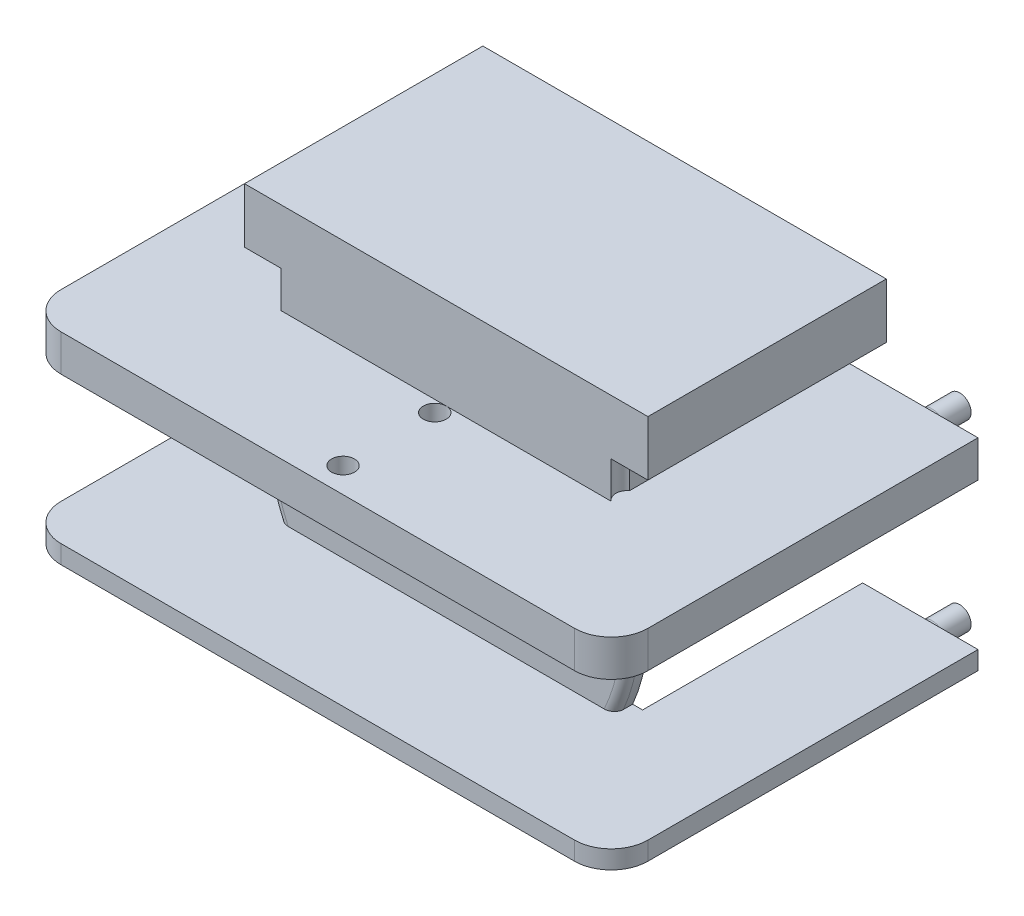
from build123d import *

# Parameters (mm, degrees)
BOSS_EXTRUDE1_DEPTH     = 1
SKETCH2_R               = 1.475
BOSS_EXTRUDE2_DEPTH     = 14
SKETCH3_R               = 3.5
BOSS_EXTRUDE3_DEPTH     = 1
SKETCH4_W               = 2
SKETCH4_H               = 17
BOSS_EXTRUDE4_DEPTH     = 12
SKETCH5_W               = 18
SKETCH5_H               = 2
BOSS_EXTRUDE5_DEPTH     = 12
SKETCH6_W               = 13
SKETCH6_H               = 2
BOSS_EXTRUDE6_DEPTH     = 5
BOSS_EXTRUDE7_DEPTH     = 12
CUT_EXTRUDE1_DEPTH      = 24.366642891
SKETCH9_W               = 2.937742252
SKETCH9_H               = 8
CUT_EXTRUDE2_DEPTH      = 12
CUT_EXTRUDE11_START     = -12
SKETCH21_R              = 10.5
SKETCH21_R_2            = 3.5
CUT_EXTRUDE11_DEPTH     = 12
SKETCH10_W              = 32
SKETCH10_H              = 2
BOSS_EXTRUDE8_DEPTH     = 7
FILLET1_R               = 0.5
SKETCH11_R              = 0.625
BOSS_EXTRUDE9_DEPTH     = 2
SKETCH14_W              = 2
SKETCH14_H              = 2
CUT_EXTRUDE5_DEPTH      = 28.874719859
SKETCH12_R              = 0.675
CUT_EXTRUDE3_DEPTH      = 2.5
CUT_EXTRUDE6_DEPTH      = 2
FILLET2_R               = 0.5
FILLET3_R               = 0.5
FILLET4_R               = 2
CUT_EXTRUDE7_DEPTH      = 28.221315288
CUT_EXTRUDE7_DEPTH_BACK = 1
SKETCH19_R              = 0.625
CUT_EXTRUDE9_DEPTH      = 2


with BuildPart() as part:
    # Sketch1 → Boss-Extrude1 (new body)
    with BuildSketch(Plane.XY):
        Polygon((-11, 6), (-11, 11), (11, 11), (11, 6), (11, -6), (-11, -6), align=None)
    extrude(amount=BOSS_EXTRUDE1_DEPTH)

    # Sketch2 → Boss-Extrude2 (add)
    with BuildSketch(Plane(origin=(0, 0, 0), x_dir=(-1, 0, 0), z_dir=(0, 0, -1))):
        with Locations(Location((0, 0, 0), (0, 0, 180))):
            Circle(SKETCH2_R)
    extrude(amount=BOSS_EXTRUDE2_DEPTH)

    # Sketch3 → Boss-Extrude3 (add)
    with BuildSketch(Plane(origin=(0, 0, 0), x_dir=(-1, 0, 0), z_dir=(0, 0, -1))):
        with Locations(Location((0, 0, 0), (0, 0, 180))):
            Circle(SKETCH3_R)
    extrude(amount=BOSS_EXTRUDE3_DEPTH)

    # Sketch4 → Boss-Extrude4 (add)
    with BuildSketch(Plane(origin=(0, 0, 0), x_dir=(-1, 0, 0), z_dir=(0, 0, -1))):
        with Locations((10, 2.5)):
            Rectangle(SKETCH4_W, SKETCH4_H)
        with Locations((-10, 2.5)):
            Rectangle(SKETCH4_W, SKETCH4_H)
    extrude(amount=BOSS_EXTRUDE4_DEPTH)

    # Sketch5 → Boss-Extrude5 (add)
    with BuildSketch(Plane(origin=(0, 0, 0), x_dir=(-1, 0, 0), z_dir=(0, 0, -1))):
        with Locations((0, 10)):
            Rectangle(SKETCH5_W, SKETCH5_H)
    extrude(amount=BOSS_EXTRUDE5_DEPTH)

    # Sketch6 → Boss-Extrude6 (add)
    with BuildSketch(Plane(origin=(11, 0, 0), x_dir=(0, 0, -1), z_dir=(1, 0, 0))):
        with Locations((5.5, -5)):
            Rectangle(SKETCH6_W, SKETCH6_H)
        with Locations((5.5, 5)):
            Rectangle(SKETCH6_W, SKETCH6_H)
    boss_extrude6 = extrude(amount=BOSS_EXTRUDE6_DEPTH)

    # Mirror1: Boss-Extrude6 across plane
    add(boss_extrude6.mirror(Plane(origin=(0, 0, 0), x_dir=(0, 0, 1), z_dir=(1, 0, 0))))

    # Sketch7 → Boss-Extrude7 (add)
    with BuildSketch(Plane(origin=(0, 0, -12), x_dir=(-1, 0, 0), z_dir=(0, 0, -1))):
        with BuildLine():
            ThreePointArc((-6.708203932, -6), (-8.407551231, -3.211398808), (-9, 0))
            Line((-9, 0), (-9, -6))
            Line((-9, -6), (-6.708203932, -6))
        make_face()
        with BuildLine():
            Line((-9, 9), (-9, 0))
            ThreePointArc((-9, 0), (-6.363961031, 6.363961031), (0, 9))
            Line((0, 9), (-9, 9))
        make_face()
    boss_extrude7 = extrude(amount=-BOSS_EXTRUDE7_DEPTH)

    # Sketch8 → Cut-Extrude1 (cut, through all)
    with BuildSketch(Plane(origin=(0, 0, -12), x_dir=(-1, 0, 0), z_dir=(0, 0, -1))):
        with BuildLine():
            Line((-11, 4), (-9.16515139, 4))
            ThreePointArc((-9.16515139, 4), (-10, 0), (-9.16515139, -4))
            Line((-9.16515139, -4), (-11, -4))
            Line((-11, -4), (-11, 4))
        make_face()
    cut_extrude1 = extrude(amount=-CUT_EXTRUDE1_DEPTH, mode=Mode.SUBTRACT)

    # Sketch9 → Cut-Extrude2 (cut)
    with BuildSketch(Plane(origin=(0, 0, -12), x_dir=(-1, 0, 0), z_dir=(0, 0, -1))):
        with Locations((-9.531128874, 0)):
            Rectangle(SKETCH9_W, SKETCH9_H)
    cut_extrude2 = extrude(amount=-CUT_EXTRUDE2_DEPTH, mode=Mode.SUBTRACT)

    # Mirror2: Boss-Extrude7, Cut-Extrude1, Cut-Extrude2 across plane
    add(boss_extrude7.mirror(Plane(origin=(0, 0, 0), x_dir=(0, 0, 1), z_dir=(1, 0, 0))))
    add(cut_extrude1.mirror(Plane(origin=(0, 0, 0), x_dir=(0, 0, 1), z_dir=(1, 0, 0))), mode=Mode.SUBTRACT)
    add(cut_extrude2.mirror(Plane(origin=(0, 0, 0), x_dir=(0, 0, 1), z_dir=(1, 0, 0))), mode=Mode.SUBTRACT)

    # Sketch21 → Cut-Extrude11 (cut)
    with BuildSketch(Plane(origin=(0, 0, -12), x_dir=(-1, 0, 0), z_dir=(0, 0, -1)).offset(CUT_EXTRUDE11_START)):
        Circle(SKETCH21_R)
        with Locations(Location((0, 0, 0), (0, 0, 180))):
            Circle(SKETCH21_R_2, mode=Mode.SUBTRACT)
    extrude(amount=CUT_EXTRUDE11_DEPTH, mode=Mode.SUBTRACT)

    # Sketch10 → Boss-Extrude8 (add)
    with BuildSketch(Plane.XY.offset(1)):
        with Locations((0, -5)):
            Rectangle(SKETCH10_W, SKETCH10_H)
        with Locations((0, 5)):
            Rectangle(SKETCH10_W, SKETCH10_H)
    extrude(amount=BOSS_EXTRUDE8_DEPTH)

    # Fillet1
    fillet1_edges = [part.edges().sort_by_distance(p)[0] for p in [
        (10, 0, 1),
        (-10, 0, 1),
    ]]
    fillet(fillet1_edges, radius=FILLET1_R)

    # Sketch11 → Boss-Extrude9 (add)
    with BuildSketch(Plane(origin=(0, 0, -12), x_dir=(-1, 0, 0), z_dir=(0, 0, -1))):
        with Locations(Location((-13, -5, 0), (0, 0, 180))):
            Circle(SKETCH11_R)
    boss_extrude9 = extrude(amount=BOSS_EXTRUDE9_DEPTH)

    # Sketch14 → Cut-Extrude5 (cut, through all)
    with BuildSketch(Plane(origin=(0, 0, -12), x_dir=(-1, 0, 0), z_dir=(0, 0, -1))):
        with Locations((10, 7)):
            Rectangle(SKETCH14_W, SKETCH14_H)
        with Locations((-10, 7)):
            Rectangle(SKETCH14_W, SKETCH14_H)
    extrude(amount=-CUT_EXTRUDE5_DEPTH, mode=Mode.SUBTRACT)

    # Sketch12 → Cut-Extrude3 (cut)
    with BuildSketch(Plane(origin=(0, 0, -12), x_dir=(-1, 0, 0), z_dir=(0, 0, -1))):
        with Locations((13, -5)):
            Circle(SKETCH12_R)
    cut_extrude3 = extrude(amount=-CUT_EXTRUDE3_DEPTH, mode=Mode.SUBTRACT)

    # Sketch16 → Cut-Extrude6 (cut)
    with BuildSketch(Plane(origin=(0, 6, 0), x_dir=(1, 0, 0), z_dir=(0, 1, 0))):
        with BuildLine():
            Line((-9, 0), (-9, -1))
            ThreePointArc((-9, -1), (-8.75, -0.5), (-9, 0))
        make_face()
    cut_extrude6 = extrude(amount=CUT_EXTRUDE6_DEPTH, mode=Mode.SUBTRACT)

    # Mirror3: Boss-Extrude9, Cut-Extrude3 across plane
    add(boss_extrude9.mirror(Plane.ZX))
    add(cut_extrude3.mirror(Plane.ZX), mode=Mode.SUBTRACT)

    # Mirror4: Cut-Extrude6 across plane
    add(cut_extrude6.mirror(Plane(origin=(0, 0, 0), x_dir=(0, 0, 1), z_dir=(1, 0, 0))), mode=Mode.SUBTRACT)

    # Fillet2
    fillet2_edges = [part.edges().sort_by_distance(p)[0] for p in [
        (12.375, -5, -12),
        (12.375, 5, -12),
    ]]
    fillet(fillet2_edges, radius=FILLET2_R)

    # Fillet3
    # the kernel refuses this fillet: 0.5 mm, written as the material it takes off along each edge
    with BuildSketch(Plane(origin=(-13, -5, -12), x_dir=(-1, 0, 0), z_dir=(0, -1, 0))) as fillet3_piece_1:
        with BuildLine():
            CenterArc((0.675 + FILLET3_R, -FILLET3_R), FILLET3_R, 90, 90)
            Line((0.675, -FILLET3_R), (0.675, 0))
            Line((0.675, 0), (0.675 + FILLET3_R, 0))
        make_face()
    revolve(axis=Axis((-13, -5, -12), (0, 0, -1)), mode=Mode.SUBTRACT)
    with BuildSketch(Plane(origin=(-13, 5, -12), x_dir=(-1, 0, 0), z_dir=(0, 1, 0))) as fillet3_piece_2:
        with BuildLine():
            CenterArc((0.675 + FILLET3_R, FILLET3_R), FILLET3_R, 180, 90)
            Line((0.675, FILLET3_R), (0.675, 0))
            Line((0.675, 0), (0.675 + FILLET3_R, 0))
        make_face()
    revolve(axis=Axis((-13, 5, -12), (0, 0, 1)), mode=Mode.SUBTRACT)

    # Fillet4
    fillet4_edges = [part.edges().sort_by_distance(p)[0] for p in [
        (16, -5, 8),
        (-16, -5, 8),
        (-16, 5, 8),
        (16, 5, 8),
    ]]
    fillet(fillet4_edges, radius=FILLET4_R)

    # Sketch17 → Cut-Extrude7 (cut, two sides: drawn at the far end of the back side and taken through both)
    with BuildSketch(Plane.XZ.offset(6).offset(-CUT_EXTRUDE7_DEPTH_BACK)):
        with BuildLine():
            Line((-16, 6), (-16, -12))
            Line((-16, -12), (-14.5, -12))
            Line((-14.5, -12), (-14.5, 6))
            ThreePointArc((-14.5, 6), (-14.353553391, 6.353553391), (-14, 6.5))
            Line((-14, 6.5), (14, 6.5))
            ThreePointArc((14, 6.5), (14.353553391, 6.353553391), (14.5, 6))
            Line((14.5, 6), (14.5, -12))
            Line((14.5, -12), (16, -12))
            Line((16, -12), (16, 6))
            ThreePointArc((16, 6), (15.414213562, 7.414213562), (14, 8))
            Line((14, 8), (-14, 8))
            ThreePointArc((-14, 8), (-15.414213562, 7.414213562), (-16, 6))
        make_face()
    extrude(amount=CUT_EXTRUDE7_DEPTH + CUT_EXTRUDE7_DEPTH_BACK, mode=Mode.SUBTRACT)

    # Sketch19 → Cut-Extrude9 (cut)
    with BuildSketch(Plane(origin=(0, 6, 0), x_dir=(1, 0, 0), z_dir=(0, 1, 0))):
        with Locations(Location((0, -1.625, 0), (0, 0, 90))):
            Circle(SKETCH19_R)
        with Locations(Location((0, -6.625, 0), (0, 0, 270))):
            Circle(SKETCH19_R)
    extrude(amount=-CUT_EXTRUDE9_DEPTH, mode=Mode.SUBTRACT)


solid = part.part
